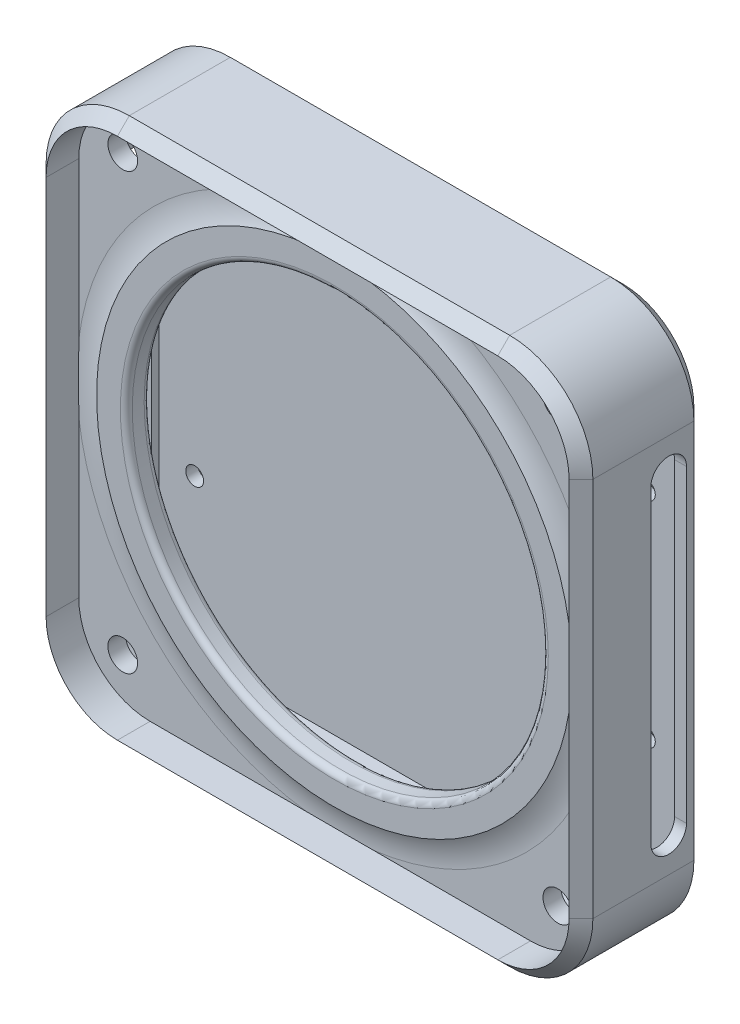
from build123d import *

# Parameters (mm, degrees)
SALIENTE_EXTRUIR2_DEPTH = 10.5
VACIADO1_T              = -1
CROQUIS4_R              = 20
CROQUIS4_R_2            = 17.5
SALIENTE_EXTRUIR3_DEPTH = 1.5
CROQUIS5_R              = 20
CROQUIS5_R_2            = 17.5
SALIENTE_EXTRUIR4_DEPTH = 0.5
REDONDEO1_R             = 5
REDONDEO2_R             = 0.5
CORTAR_EXTRUIR1_DEPTH   = 53.490475346
CHAFL_N1_SIZE           = 1
CHAFL_N2_SIZE           = 1
CROQUIS7_R              = 0.75
CORTAR_EXTRUIR2_DEPTH   = 1
CROQUIS8_R              = 0.5
CORTAR_EXTRUIR3_DEPTH   = 10
CROQUIS9_R              = 1.25
CORTAR_EXTRUIR4_DEPTH   = 1.5


# Some blends are built 0.0001 mm under size
with BuildPart() as part:
    # Croquis3 → Saliente-Extruir2 (new body)
    with BuildSketch(Plane.XY):
        with BuildLine():
            Line((-16, 23), (16, 23))
            ThreePointArc((16, 23), (20.949747468, 20.949747468), (23, 16))
            Line((23, 16), (23, -16))
            ThreePointArc((23, -16), (20.949747468, -20.949747468), (16, -23))
            Line((16, -23), (-16, -23))
            ThreePointArc((-16, -23), (-20.949747468, -20.949747468), (-23, -16))
            Line((-23, -16), (-23, 16))
            ThreePointArc((-23, 16), (-20.949747468, 20.949747468), (-16, 23))
        make_face()
    extrude(amount=SALIENTE_EXTRUIR2_DEPTH)

    # Vaciado1
    vaciado1_openings = [part.faces().sort_by_distance(p)[0] for p in [
        (0, 0, 10.5),
    ]]
    offset(amount=VACIADO1_T, openings=vaciado1_openings, kind=Kind.INTERSECTION)



with BuildPart() as body_2:
    # Croquis4 → Saliente-Extruir3 (new body)
    # profile 1 of 2: a face of its own
    with BuildSketch(Plane.XY.offset(6.25)):
        with BuildLine():
            Line((22, -16), (22, 16))
            ThreePointArc((22, 16), (20.242640687, 20.242640687), (16, 22))
            Line((16, 22), (-16, 22))
            ThreePointArc((-16, 22), (-20.242640687, 20.242640687), (-22, 16))
            Line((-22, 16), (-22, -16))
            ThreePointArc((-22, -16), (-20.242640687, -20.242640687), (-16, -22))
            Line((-16, -22), (16, -22))
            ThreePointArc((16, -22), (20.242640687, -20.242640687), (22, -16))
        make_face()
        Circle(CROQUIS4_R, mode=Mode.SUBTRACT)
    # profile 2 of 2: a face of its own
    with BuildSketch(Plane.XY.offset(6.25)):
        Circle(CROQUIS4_R)
        Circle(CROQUIS4_R_2, mode=Mode.SUBTRACT)
    extrude(amount=SALIENTE_EXTRUIR3_DEPTH)


with BuildPart() as part_1:
    add(part.part)

    add(body_2.part)  # Saliente-Extruir4 merges body 2
    # Croquis5 → Saliente-Extruir4 (add)
    with BuildSketch(Plane.XY.offset(7.75)):
        Circle(CROQUIS5_R)
        Circle(CROQUIS5_R_2, mode=Mode.SUBTRACT)
    extrude(amount=SALIENTE_EXTRUIR4_DEPTH)

    # Redondeo1
    # the kernel refuses this fillet: 5 mm, written as the material it adds along each edge
    with BuildSketch(Plane(origin=(0, 0, 7.75), x_dir=(1, 0, 0), z_dir=(0, -1, 0))) as redondeo1_piece_1:
        with BuildLine():
            CenterArc((22.179449472, 5), REDONDEO1_R, 244.158067237, 25.841932763)
            Line((22.179449472, 0), (22.179449472, -0.1))
            Line((22.179449472, -0.1), (20, -0.1))
            Line((20, -0.1), (19.9, 0))
            ThreePointArc((19.9, 0), (19.9, 0.25), (19.956411011, 0.41))
            Line((19.956411011, 0.41), (20, 0.5))
        make_face()
    revolve(axis=Axis((0, 0, 7.75), (0, 0, 1)))

    # Redondeo2
    redondeo2_edges = [part_1.edges().sort_by_distance(p)[0] for p in [
        (-17.5, 0, 6.25),
        (-17.5, 0, 8.25),
    ]]
    fillet(redondeo2_edges, radius=REDONDEO2_R)

    # Croquis6 → Cortar-Extruir1 (cut, through all)
    with BuildSketch(Plane.ZY.offset(23)):
        with BuildLine():
            Line((1.625, -13), (1.625, 13))
            ThreePointArc((1.625, 13), (3.125, 14.5), (4.625, 13))
            Line((4.625, 13), (4.625, -13))
            ThreePointArc((4.625, -13), (3.125, -14.5), (1.625, -13))
        make_face()
    extrude(amount=-CORTAR_EXTRUIR1_DEPTH, mode=Mode.SUBTRACT)

    # Chaflán1
    chafl_n1_edges = [part_1.edges().sort_by_distance(p)[0] for p in [
        (-20.949747468, 20.949747468, 10.5),
        (-23, 0, 10.5),
        (-20.949747468, -20.949747468, 10.5),
        (0, -23, 10.5),
        (20.949747468, -20.949747468, 10.5),
        (23, 0, 10.5),
        (20.949747468, 20.949747468, 10.5),
        (0, 23, 10.5),
    ]]
    chamfer(chafl_n1_edges, length=CHAFL_N1_SIZE - 0.0001)  # a hair under: the kernel refuses the full size

    # Chaflán2
    chafl_n2_edges = [part_1.edges().sort_by_distance(p)[0] for p in [
        (0, 23, 0),
        (20.949747468, 20.949747468, 0),
        (23, 0, 0),
        (20.949747468, -20.949747468, 0),
        (0, -23, 0),
        (-20.949747468, -20.949747468, 0),
        (-23, 0, 0),
        (-20.949747468, 20.949747468, 0),
    ]]
    chamfer(chafl_n2_edges, length=CHAFL_N2_SIZE)

    # Croquis7 → Cortar-Extruir2 (cut)
    with BuildSketch(Plane(origin=(0, 0, 0), x_dir=(-1, 0, 0), z_dir=(0, 0, -1))):
        with Locations((-19, 9)):
            Circle(CROQUIS7_R)
        with Locations(Location((-19, -9, 0), (0, 0, 180))):
            Circle(CROQUIS7_R)
        with Locations((19, -9)):
            Circle(CROQUIS7_R)
        with Locations(Location((19, 9, 0), (0, 0, 180))):
            Circle(CROQUIS7_R)
    extrude(amount=-CORTAR_EXTRUIR2_DEPTH, mode=Mode.SUBTRACT)

    # Croquis8 → Cortar-Extruir3 (cut)
    with BuildSketch(Plane.XZ.offset(23)):
        with Locations(Location((0, 5.25, 0), (0, 0, 270))):
            Circle(CROQUIS8_R)
    extrude(amount=-CORTAR_EXTRUIR3_DEPTH, mode=Mode.SUBTRACT)

    # Croquis9 → Cortar-Extruir4 (cut)
    with BuildSketch(Plane.XY.offset(7.75)):
        with Locations((18.3, 18.3)):
            Circle(CROQUIS9_R)
        with Locations(Location((-18.3, 18.3, 0), (0, 0, 180))):
            Circle(CROQUIS9_R)
        with Locations((-18.3, -18.3)):
            Circle(CROQUIS9_R)
        with Locations(Location((18.3, -18.3, 0), (0, 0, 180))):
            Circle(CROQUIS9_R)
    extrude(amount=-CORTAR_EXTRUIR4_DEPTH, mode=Mode.SUBTRACT)


solid = part_1.part
